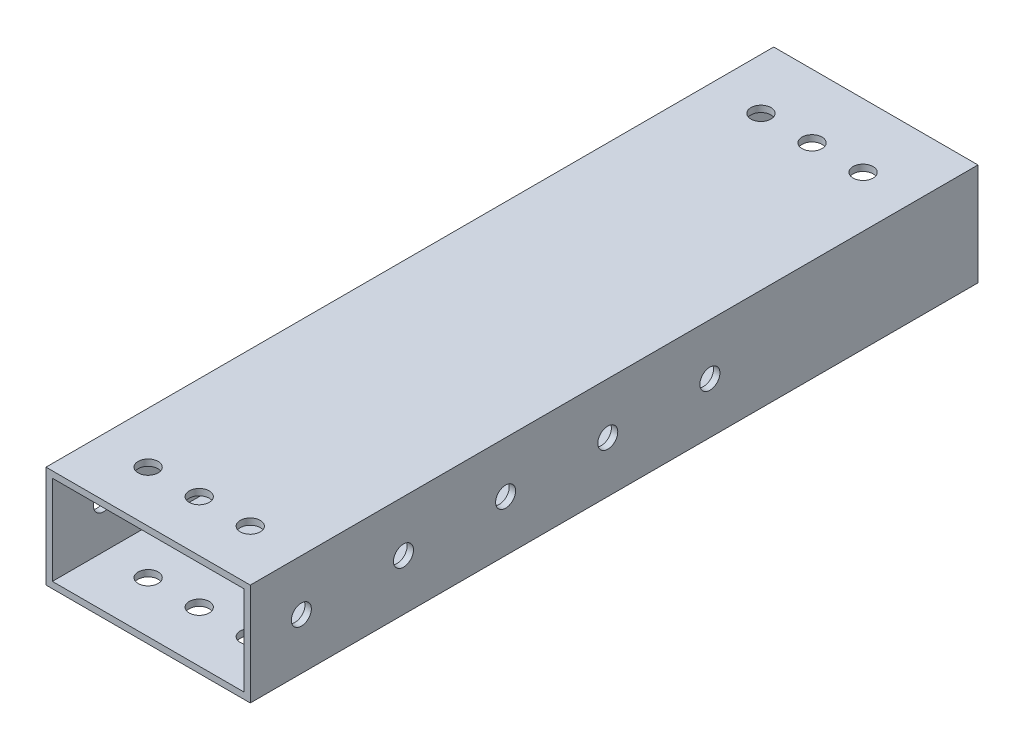
from build123d import *

# Parameters (mm, degrees)
SKETCH1_W           = 50.8
SKETCH1_H           = 25.4
SKETCH1_W_2         = 47.625
SKETCH1_H_2         = 22.225
BOSS_EXTRUDE1_DEPTH = 180.975
SKETCH2_R           = 2.4892
CUT_EXTRUDE1_DEPTH  = 185.505475867
SKETCH3_R           = 2.4892
CUT_EXTRUDE2_DEPTH  = 189.398196979


with BuildPart() as part:
    # Sketch1 → Boss-Extrude1 (new body)
    with BuildSketch(Plane.XY):
        Rectangle(SKETCH1_W, SKETCH1_H)
        Rectangle(SKETCH1_W_2, SKETCH1_H_2, mode=Mode.SUBTRACT)
    extrude(amount=BOSS_EXTRUDE1_DEPTH)

    # Sketch2 → Cut-Extrude1 (cut, through all)
    with BuildSketch(Plane(origin=(0, 12.7, 0), x_dir=(1, 0, 0), z_dir=(0, 1, 0))):
        with Locations((-12.7, -15.875)):
            Circle(SKETCH2_R)
        with Locations((0, -15.875)):
            Circle(SKETCH2_R)
        with Locations((12.7, -15.875)):
            Circle(SKETCH2_R)
        with Locations((-12.7, -168.275)):
            Circle(SKETCH2_R)
        with Locations((0, -168.275)):
            Circle(SKETCH2_R)
        with Locations((12.7, -168.275)):
            Circle(SKETCH2_R)
    extrude(amount=-CUT_EXTRUDE1_DEPTH, mode=Mode.SUBTRACT)

    # Sketch3 → Cut-Extrude2 (cut, through all)
    with BuildSketch(Plane(origin=(25.4, 0, 0), x_dir=(0, 0, -1), z_dir=(1, 0, 0))):
        with Locations((-168.275, 0)):
            Circle(SKETCH3_R)
        with Locations((-142.875, 0)):
            Circle(SKETCH3_R)
        with Locations((-117.475, 0)):
            Circle(SKETCH3_R)
        with Locations((-92.075, 0)):
            Circle(SKETCH3_R)
        with Locations((-66.675, 0)):
            Circle(SKETCH3_R)
    extrude(amount=-CUT_EXTRUDE2_DEPTH, mode=Mode.SUBTRACT)


solid = part.part
